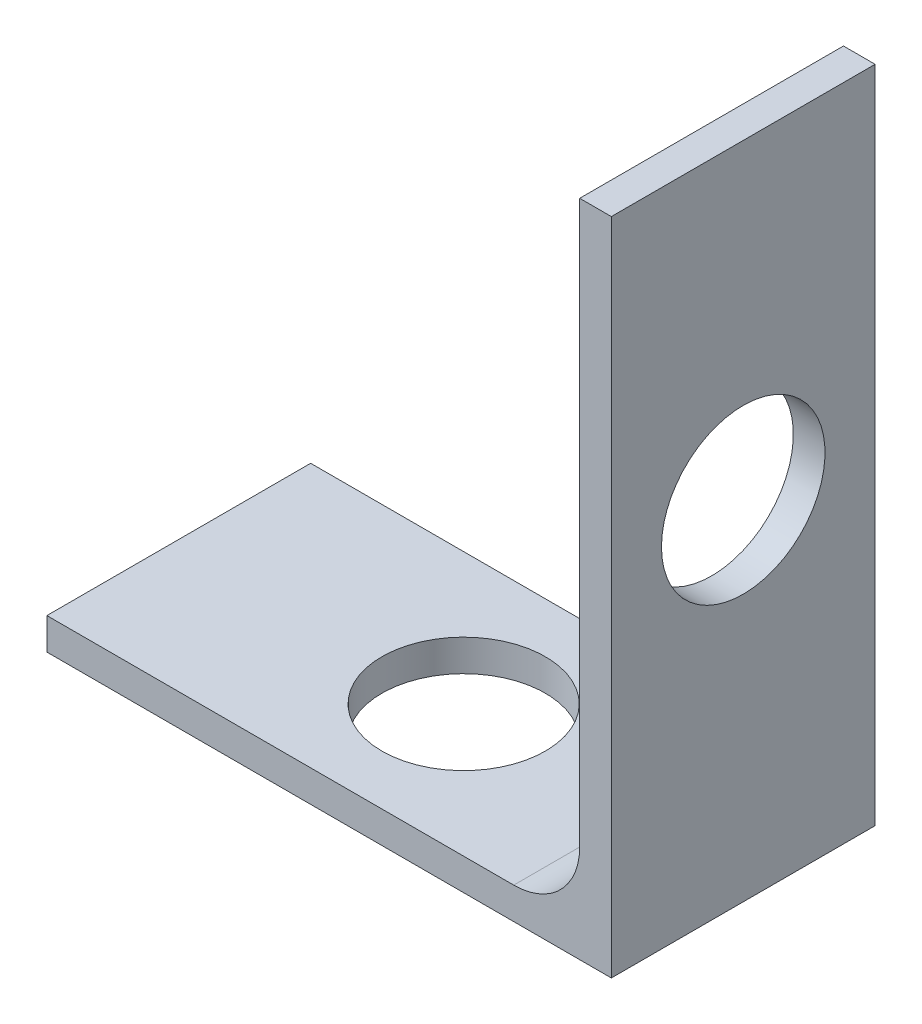
from build123d import *

# Parameters (mm, degrees)
BOSS_EXTRUDE1_DEPTH = 12.7
SKETCH2_R           = 3.937
CUT_EXTRUDE1_DEPTH  = 6.35
SKETCH4_R           = 3.937
CUT_EXTRUDE2_DEPTH  = 6.35
FILLET2_R           = 3.175


with BuildPart() as part:
    # Sketch1 → Boss-Extrude1 (new body)
    with BuildSketch(Plane.XY):
        Polygon((0, 0), (27.178, 0), (27.178, 31.75), (25.654, 31.75), (25.654, 1.524), (0, 1.524), align=None)
    extrude(amount=BOSS_EXTRUDE1_DEPTH)

    # Sketch2 → Cut-Extrude1 (cut)
    with BuildSketch(Plane.ZY.offset(-25.654)):
        with Locations((6.35, 16.764)):
            Circle(SKETCH2_R)
    extrude(amount=-CUT_EXTRUDE1_DEPTH, mode=Mode.SUBTRACT)

    # Sketch4 → Cut-Extrude2 (cut)
    with BuildSketch(Plane(origin=(0, 1.524, 0), x_dir=(1, 0, 0), z_dir=(0, 1, 0))):
        with Locations((13.716, -6.35)):
            Circle(SKETCH4_R)
    extrude(amount=-CUT_EXTRUDE2_DEPTH, mode=Mode.SUBTRACT)

    # Fillet2
    fillet2_edges = [part.edges().sort_by_distance(p)[0] for p in [
        (25.654, 1.524, 6.35),
    ]]
    fillet(fillet2_edges, radius=FILLET2_R)


solid = part.part
